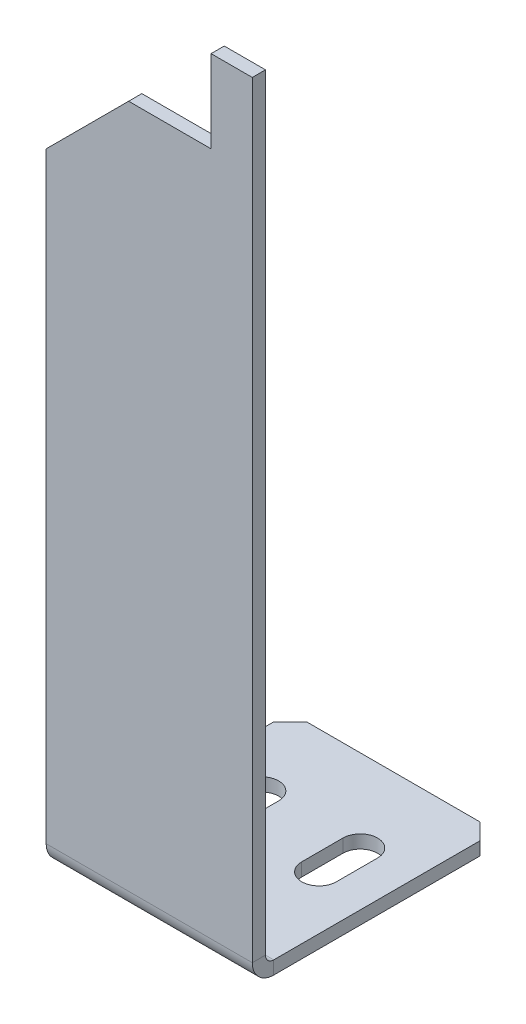
from build123d import *

# Parameters (mm, degrees)
SKETCH_1_W                       = 25
SKETCH_1_H                       = 1.6
SM_BASE_FLANGE_1_DEPTH           = 14
CUT_EXTRUDE_2_REACH              = 30.698
SM_EDGE_FLANGE_1_STRIP_W         = 8.4
SM_EDGE_FLANGE_1_STRIP_H         = 1.6
SM_EDGE_FLANGE_1_STRIP_CUT_DEPTH = 25
SM_EDGE_FLANGE_1_DEPTH           = 25
CUT_EXTRUDE_1_REACH              = 104.705
SKETCH_10_W                      = 20
SKETCH_10_H                      = 10
CHAMFER_1_SIZE                   = 10
CHAMFER_2_SIZE                   = 2


# Sheet-metal steps are written as plain solids
with BuildPart() as part:
    # Sketch 1 → 基材-凸緣1 (new, symmetric)
    with BuildSketch(Plane.XY):
        with Locations((12.5, 0.8)):
            Rectangle(SKETCH_1_W, SKETCH_1_H)
    extrude(amount=SM_BASE_FLANGE_1_DEPTH, both=True)

    # 草圖11 → 除料-伸長2 (cut, up to next)
    with BuildSketch(Plane.XZ, mode=Mode.PRIVATE) as cut_extrude_2_sk1:
        with BuildLine():
            Line((16.4, 1), (16.4, -4))
            ThreePointArc((16.4, -4), (18.5, -6.1), (20.6, -4))
            Line((20.6, -4), (20.6, 1))
            ThreePointArc((20.6, 1), (18.5, 3.1), (16.4, 1))
        make_face()
    cut_extrude_2_tool1 = extrude(cut_extrude_2_sk1.sketch, amount=-CUT_EXTRUDE_2_REACH, mode=Mode.PRIVATE) & part.part
    # 草圖11 → 除料-伸長2 (cut, up to next)
    with BuildSketch(Plane.XZ, mode=Mode.PRIVATE) as cut_extrude_2_sk2:
        with BuildLine():
            Line((4.4, 1), (4.4, -4))
            ThreePointArc((4.4, -4), (6.5, -6.1), (8.6, -4))
            Line((8.6, -4), (8.6, 1))
            ThreePointArc((8.6, 1), (6.5, 3.1), (4.4, 1))
        make_face()
    cut_extrude_2_tool2 = extrude(cut_extrude_2_sk2.sketch, amount=-CUT_EXTRUDE_2_REACH, mode=Mode.PRIVATE) & part.part
    add(cut_extrude_2_tool1.solids().sort_by_distance((18.5, 0, -1.5))[0], mode=Mode.SUBTRACT)
    add(cut_extrude_2_tool2.solids().sort_by_distance((6.5, 0, -1.5))[0], mode=Mode.SUBTRACT)

    # 邊線-凸緣1 strip (across the edge) → 邊線-凸緣1 strip cut (cut)
    with BuildSketch(Plane(origin=(0, 1.6, 14), x_dir=(0, 0, -1), z_dir=(1, 0, 0))):
        with Locations((-3.2, -0.8)):
            Rectangle(SM_EDGE_FLANGE_1_STRIP_W, SM_EDGE_FLANGE_1_STRIP_H)
    extrude(amount=SM_EDGE_FLANGE_1_STRIP_CUT_DEPTH, mode=Mode.SUBTRACT)

    # 邊線-凸緣1 section (across the edge) → 邊線-凸緣1 (add)
    with BuildSketch(Plane(origin=(0, 1.6, 14), x_dir=(0, 0, -1), z_dir=(1, 0, 0))):
        with BuildLine():
            Line((-1.6, 1), (-1.6, 94))
            Line((-1.6, 94), (0, 94))
            Line((0, 94), (0, 1))
            ThreePointArc((0, 1), (0.292893219, 0.292893219), (1, 0))
            Line((1, 0), (1, -1.6))
            ThreePointArc((1, -1.6), (-0.838477631, -0.838477631), (-1.6, 1))
        make_face()
    extrude(amount=SM_EDGE_FLANGE_1_DEPTH)

    # 草圖10 → 除料-伸長1 (cut, up to next)
    with BuildSketch(Plane(origin=(0, 0, 14), x_dir=(-1, 0, 0), z_dir=(0, 0, -1)), mode=Mode.PRIVATE) as cut_extrude_1_sk1:
        with Locations((-10, 90.6)):
            Rectangle(SKETCH_10_W, SKETCH_10_H)
    cut_extrude_1_tool1 = extrude(cut_extrude_1_sk1.sketch, amount=-CUT_EXTRUDE_1_REACH, mode=Mode.PRIVATE) & part.part
    add(cut_extrude_1_tool1.solids().sort_by_distance((10, 90.6, 14))[0], mode=Mode.SUBTRACT)

    # 導角1
    chamfer_1_edges = [part.edges().sort_by_distance(p)[0] for p in [
        (0, 85.6, 14.8),
    ]]
    chamfer(chamfer_1_edges, length=CHAMFER_1_SIZE)

    # 導角2
    chamfer_2_edges = [part.edges().sort_by_distance(p)[0] for p in [
        (25, 0.8, -14),
        (0, 0.8, -14),
    ]]
    chamfer(chamfer_2_edges, length=CHAMFER_2_SIZE)


solid = part.part
